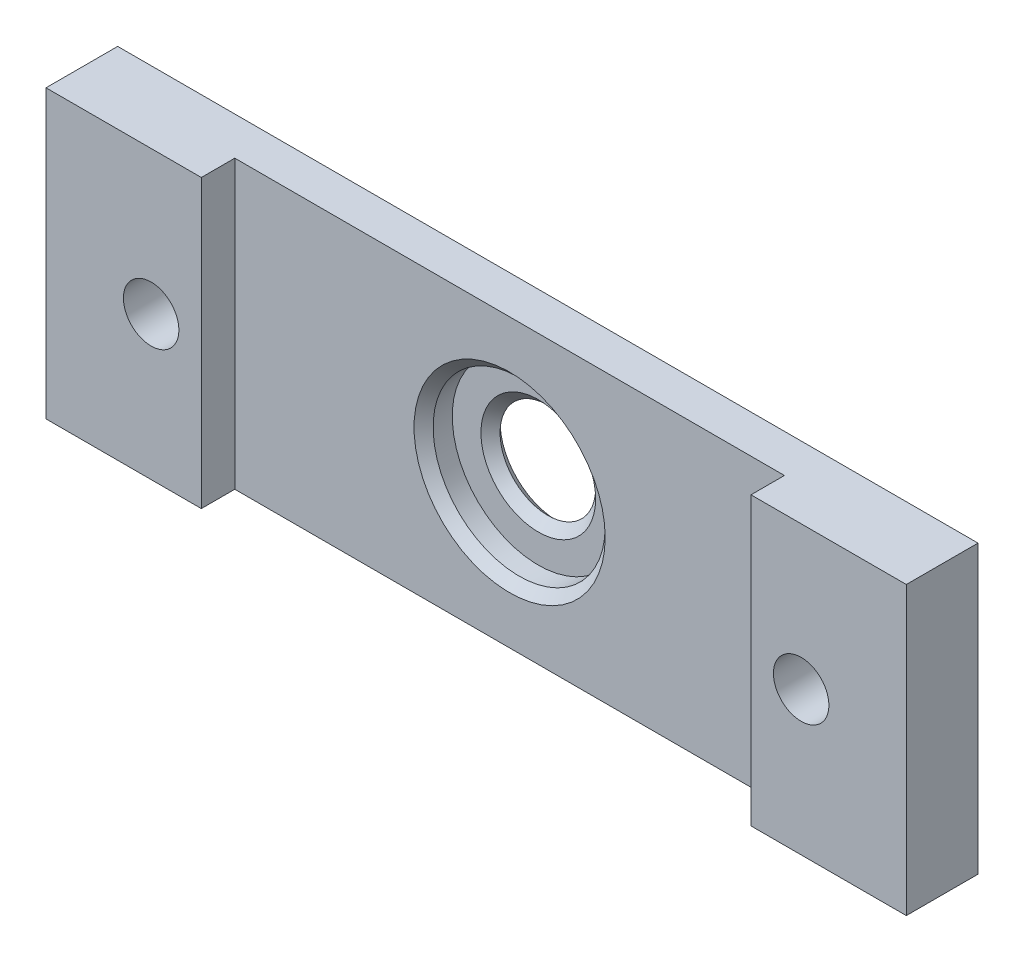
from build123d import *

# Parameters (mm, degrees)
SKETCH_1_W               = 90
SKETCH_1_H               = 30
EXTRUDE_1_DEPTH          = 5
SKETCH_2_W               = 16.25
SKETCH_2_H               = 30
EXTRUDE_2_DEPTH          = 3.5
CUT_EXTRUDE_1_DEPTH      = 49.189729196
CUT_EXTRUDE_1_DEPTH_BACK = 49.189729196
SKETCH_3_R               = 2.9
CHAMFER_1_SIZE           = 1
CUT_EXTRUDE_2_DEPTH      = 48.696960071
CUT_EXTRUDE_2_DEPTH_BACK = 3
SKETCH_4_R               = 9
CHAMFER_2_SIZE           = 1
CUT_EXTRUDE_3_DEPTH      = 48.877447718
CUT_EXTRUDE_3_DEPTH_BACK = 48.877447718
SKETCH_5_R               = 5
CHAMFER_3_SIZE           = 1


with BuildPart() as part:
    # 草图1 → 凸台-拉伸1 (new body)
    with BuildSketch(Plane.XY):
        Rectangle(SKETCH_1_W, SKETCH_1_H)
    extrude(amount=EXTRUDE_1_DEPTH)

    # 草图2 → 凸台-拉伸2 (add)
    with BuildSketch(Plane.XY.offset(5)):
        with Locations((36.875, 0)):
            Rectangle(SKETCH_2_W, SKETCH_2_H)
        with Locations((-36.875, 0)):
            Rectangle(SKETCH_2_W, SKETCH_2_H)
    extrude(amount=EXTRUDE_2_DEPTH)

    # 草图3 → 切除-拉伸1 (cut, two sides: drawn at the far end of the back side and taken through both)
    with BuildSketch(Plane(origin=(0, 0, 0), x_dir=(-1, 0, 0), z_dir=(0, 0, -1)).offset(-CUT_EXTRUDE_1_DEPTH_BACK)):
        with Locations((34, 0)):
            Circle(SKETCH_3_R)
        with Locations((-34, 0)):
            Circle(SKETCH_3_R)
    extrude(amount=CUT_EXTRUDE_1_DEPTH + CUT_EXTRUDE_1_DEPTH_BACK, mode=Mode.SUBTRACT)

    # 倒角1
    chamfer_1_edges = [part.edges().sort_by_distance(p)[0] for p in [
        (-31.1, 0, 0),
        (36.9, 0, 0),
        (0, 15, 0),
        (45, 0, 0),
        (0, -15, 0),
        (-45, 0, 0),
    ]]
    chamfer(chamfer_1_edges, length=CHAMFER_1_SIZE)

    # 草图4 → 切除-拉伸2 (cut, two sides: drawn at the far end of the back side and taken through both)
    with BuildSketch(Plane.XY.offset(5).offset(-CUT_EXTRUDE_2_DEPTH_BACK)):
        Circle(SKETCH_4_R)
    extrude(amount=CUT_EXTRUDE_2_DEPTH + CUT_EXTRUDE_2_DEPTH_BACK, mode=Mode.SUBTRACT)

    # 倒角2
    chamfer_2_edges = [part.edges().sort_by_distance(p)[0] for p in [
        (-9, 0, 5),
    ]]
    chamfer(chamfer_2_edges, length=CHAMFER_2_SIZE)

    # 草图5 → 切除-拉伸3 (cut, two sides: drawn at the far end of the back side and taken through both)
    with BuildSketch(Plane.XY.offset(2).offset(-CUT_EXTRUDE_3_DEPTH_BACK)):
        Circle(SKETCH_5_R)
    extrude(amount=CUT_EXTRUDE_3_DEPTH + CUT_EXTRUDE_3_DEPTH_BACK, mode=Mode.SUBTRACT)

    # 倒角3
    chamfer_3_edges = [part.edges().sort_by_distance(p)[0] for p in [
        (-5, 0, 2),
        (-5, 0, 0),
    ]]
    chamfer(chamfer_3_edges, length=CHAMFER_3_SIZE - 0.0001)  # a hair under: the kernel refuses the full size


solid = part.part
